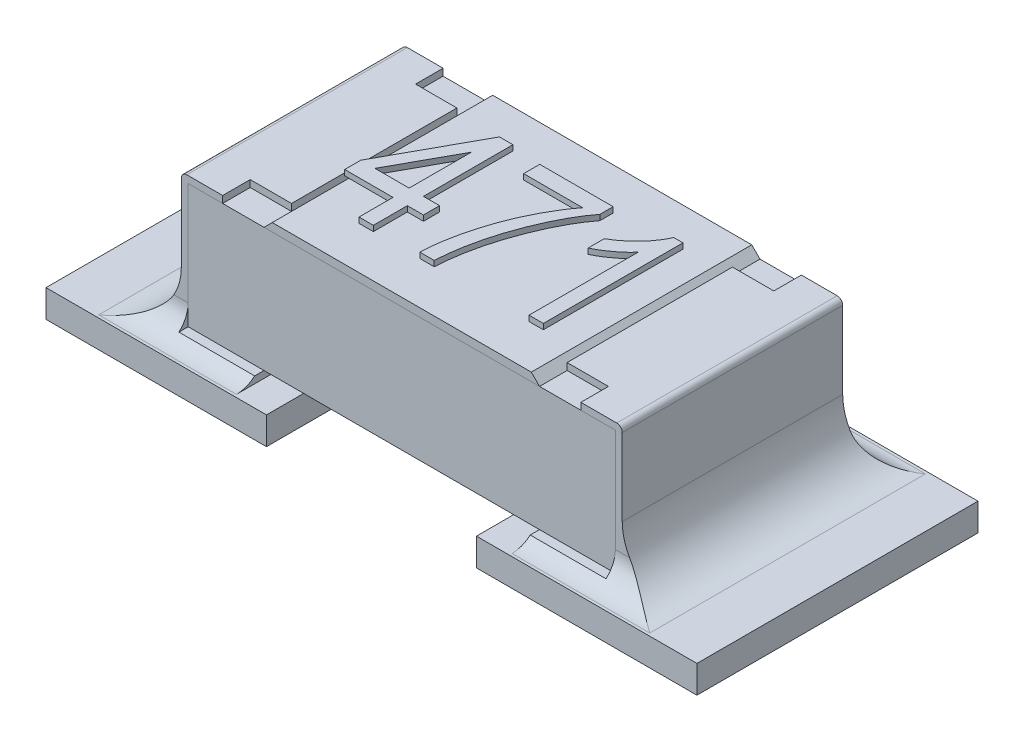
from build123d import *

# Parameters (mm, degrees)
SKETCH1_W             = 0.8
SKETCH1_H             = 0.45
BOSS_EXTRUDE1_DEPTH   = 0.775
BOSS_EXTRUDE2_DEPTH   = 0.4
BOSS_EXTRUDE2_2_DEPTH = 0.4
SKETCH3_W             = 0.15
SKETCH3_H             = 0.1
CUT_EXTRUDE1_DEPTH    = 0.025
BOSS_EXTRUDE3_DEPTH   = 0.4
SKETCH7_W             = 0.8
SKETCH7_H             = 1.02
BOSS_EXTRUDE5_DEPTH   = 0.1
FILLET3_R             = 0.2
FILLET4_R             = 0.2
FILLET5_R             = 0.1
FILLET6_R             = 0.1
BOSS_EXTRU_1_DEPTH    = 0.02


with BuildPart() as part:
    # Sketch1 → Boss-Extrude1 (new, symmetric)
    with BuildSketch(Plane(origin=(0, 0, 0), x_dir=(0, 0, -1), z_dir=(1, 0, 0))):
        with Locations((0, 0.35)):
            Rectangle(SKETCH1_W, SKETCH1_H)
    extrude(amount=BOSS_EXTRUDE1_DEPTH, both=True)


with BuildPart() as body_2:
    # Sketch2 → Boss-Extrude2 (new, symmetric)
    with BuildSketch(Plane.XY):
        with BuildLine():
            Line((-0.5, 0.6), (-0.78, 0.6))
            ThreePointArc((-0.78, 0.6), (-0.794142136, 0.594142136), (-0.8, 0.58))
            Line((-0.8, 0.58), (-0.8, 0.1))
            Line((-0.8, 0.1), (-0.5, 0.1))
            Line((-0.5, 0.1), (-0.5, 0.125))
            Line((-0.5, 0.125), (-0.775, 0.125))
            Line((-0.775, 0.125), (-0.775, 0.575))
            Line((-0.775, 0.575), (-0.5, 0.575))
            Line((-0.5, 0.575), (-0.5, 0.6))
        make_face()
    extrude(amount=BOSS_EXTRUDE2_DEPTH, both=True)


with BuildPart() as body_3:
    # Sketch2 → Boss-Extrude2 2 (new, symmetric)
    with BuildSketch(Plane.XY):
        with BuildLine():
            Line((0.5, 0.575), (0.5, 0.6))
            Line((0.5, 0.6), (0.78, 0.6))
            ThreePointArc((0.78, 0.6), (0.794142136, 0.594142136), (0.8, 0.58))
            Line((0.8, 0.58), (0.8, 0.1))
            Line((0.8, 0.1), (0.5, 0.1))
            Line((0.5, 0.1), (0.5, 0.125))
            Line((0.5, 0.125), (0.775, 0.125))
            Line((0.775, 0.125), (0.775, 0.575))
            Line((0.775, 0.575), (0.5, 0.575))
        make_face()
    extrude(amount=BOSS_EXTRUDE2_2_DEPTH, both=True)


with BuildPart() as cut_extrude1_tool:
    # Sketch3 → Cut-Extrude1 (new body)
    with BuildSketch(Plane(origin=(0, 0.6, 0), x_dir=(1, 0, 0), z_dir=(0, 1, 0))):
        with Locations((-0.575, 0.35)):
            Rectangle(SKETCH3_W, SKETCH3_H)
        with Locations((-0.575, -0.35)):
            Rectangle(SKETCH3_W, SKETCH3_H)
        with Locations((0.575, -0.35)):
            Rectangle(SKETCH3_W, SKETCH3_H)
        with Locations((0.575, 0.35)):
            Rectangle(SKETCH3_W, SKETCH3_H)
    extrude(amount=-CUT_EXTRUDE1_DEPTH)


with BuildPart() as body_2_1:
    add(body_2.part)

    # Cut-Extrude1: cut by cut_extrude1_tool
    add(cut_extrude1_tool.part, mode=Mode.SUBTRACT)



with BuildPart() as body_3_1:
    add(body_3.part)

    # Cut-Extrude1: cut by cut_extrude1_tool
    add(cut_extrude1_tool.part, mode=Mode.SUBTRACT)


with BuildPart() as body_4:
    # Sketch4 → Boss-Extrude3 (new, symmetric)
    with BuildSketch(Plane.XY):
        Polygon((-0.5, 0.575), (0.5, 0.575), (0.47, 0.605), (-0.47, 0.605), align=None)
    extrude(amount=BOSS_EXTRUDE3_DEPTH, both=True)

    # Esquisse2 → Boss.-Extru.1 (add)
    # profile 1 of 3: a face of its own
    with BuildSketch(Plane(origin=(0, 0.605, 0), x_dir=(1, 0, 0), z_dir=(0, 1, 0))):
        Polygon((-0.309886691, -0.245221888), (-0.309886691, -0.121845264), (-0.485211367, -0.121845264), (-0.485211367, -0.063403706), (-0.306944321, 0.261271619), (-0.257938639, 0.261271619), (-0.257938639, -0.063403706), (-0.199497081, -0.063403706), (-0.199497081, -0.121845264), (-0.257938639, -0.121845264), (-0.257938639, -0.245221888), align=None)
        Polygon((-0.309886691, -0.063403706), (-0.309886691, 0.162550028), (-0.433973542, -0.063403706), align=None, mode=Mode.SUBTRACT)
    # profile 2 of 3: a face of its own
    with BuildSketch(Plane(origin=(0, 0.605, 0), x_dir=(1, 0, 0), z_dir=(0, 1, 0))):
        with BuildLine():
            Line((-0.147549029, 0.189843048), (-0.147549029, 0.248284606))
            Line((-0.147549029, 0.248284606), (0.118684737, 0.248284606))
            Line((0.118684737, 0.248284606), (0.118684737, 0.200496457))
            add(Edge.make_bspline(
                [(0.118684737, 0.200496457), (0.11374506, 0.193883112), (0.103690577, 0.180421956), (0.089629665, 0.15888939), (0.075954824, 0.135956865), (0.062653235, 0.111604996), (0.049881166, 0.085755524), (0.037509723, 0.058489528), (0.02565439, 0.029704454), (0.014307924, -0.000233926), (0.003675417, -0.030854621), (-0.005742033, -0.061692329), (-0.013988634, -0.092449334), (-0.020962495, -0.123124227), (-0.026905964, -0.153701204), (-0.031550699, -0.184233606), (-0.035053075, -0.21472856), (-0.036458112, -0.235069144), (-0.037159418, -0.245221888)],
                knots=[0, 0, 0, 0, 0.828235292, 1.685834407, 2.579347319, 3.50739146, 4.469751317, 5.472290501, 6.511687755, 7.593421113, 8.685056077, 9.764080991, 10.828622054, 11.880069368, 12.920502423, 13.954003105, 14.978766756, 16, 16, 16, 16], degree=3))
            Line((-0.037159418, -0.245221888), (-0.08910747, -0.245221888))
            add(Edge.make_bspline(
                [(-0.08910747, -0.245221888), (-0.088946966, -0.239876054), (-0.088619538, -0.228970553), (-0.087305949, -0.2122975), (-0.085650055, -0.194926574), (-0.083168557, -0.176934464), (-0.080118357, -0.158294079), (-0.076411626, -0.13902896), (-0.072322113, -0.11904052), (-0.065773685, -0.091649168), (-0.056543919, -0.057339348), (-0.043279746, -0.016938754), (-0.028326509, 0.022538381), (-0.011308019, 0.060586243), (0.006839864, 0.096834643), (0.025951357, 0.13052881), (0.045471344, 0.161610603), (0.059774471, 0.180599823), (0.066736685, 0.189843048)],
                knots=[0, 0, 0, 0, 0.54755489, 1.117011975, 1.712111195, 2.334110413, 2.976306168, 3.645990646, 4.342828197, 5.06521062, 6.529487471, 7.979439287, 9.417531512, 10.850025522, 12.245424871, 13.566691952, 14.815558909, 16, 16, 16, 16], degree=3))
            Line((0.066736685, 0.189843048), (-0.147549029, 0.189843048))
        make_face()
    # profile 3 of 3: a face of its own
    with BuildSketch(Plane(origin=(0, 0.605, 0), x_dir=(1, 0, 0), z_dir=(0, 1, 0))):
        with BuildLine():
            Line((0.358944478, -0.245221888), (0.306996426, -0.245221888))
            Line((0.306996426, -0.245221888), (0.306996426, 0.150882009))
            add(Edge.make_bspline(
                [(0.306996426, 0.150882009), (0.303806106, 0.147209677), (0.297194172, 0.139598774), (0.285716194, 0.128775009), (0.272925255, 0.1176135), (0.258763988, 0.106782892), (0.244334784, 0.096408923), (0.230083263, 0.087284837), (0.216543567, 0.079346193), (0.207460341, 0.075031174), (0.203100322, 0.072959931)],
                knots=[0, 0, 0, 0, 0.892555828, 1.849821039, 2.893015883, 4.008277588, 5.121255548, 6.154629642, 7.114207698, 8, 8, 8, 8], degree=3))
            Line((0.203100322, 0.072959931), (0.203100322, 0.131401489))
            add(Edge.make_bspline(
                [(0.203100322, 0.131401489), (0.210107225, 0.13561851), (0.224061033, 0.144016443), (0.243612145, 0.158564375), (0.262081827, 0.174266475), (0.278918027, 0.191287267), (0.293992994, 0.208833156), (0.306932185, 0.226343975), (0.317541502, 0.243633673), (0.322745711, 0.255526991), (0.325259413, 0.261271619)],
                knots=[0, 0, 0, 0, 1.082272232, 2.155277244, 3.222407096, 4.289527553, 5.32168536, 6.282742408, 7.170542132, 8, 8, 8, 8], degree=3))
            Line((0.325259413, 0.261271619), (0.358944478, 0.261271619))
            Line((0.358944478, 0.261271619), (0.358944478, -0.245221888))
        make_face()
    extrude(amount=BOSS_EXTRU_1_DEPTH)


with BuildPart() as body_2_2:
    add(body_2_1.part)

    add(body_3_1.part)  # Boss-Extrude5 merges body 3
    # Sketch7 → Boss-Extrude5 (add)
    with BuildSketch(Plane(origin=(0, 0, 0), x_dir=(1, 0, 0), z_dir=(0, 1, 0))):
        with Locations((-0.781, 0)):
            Rectangle(SKETCH7_W, SKETCH7_H)
        with Locations((0.781, 0)):
            Rectangle(SKETCH7_W, SKETCH7_H)
    extrude(amount=BOSS_EXTRUDE5_DEPTH)

    # Fillet3
    fillet3_edges = [body_2_2.edges().sort_by_distance(p)[0] for p in [
        (-0.8, 0.1, 0),
    ]]
    fillet(fillet3_edges, radius=FILLET3_R)

    # Fillet4
    fillet4_edges = [body_2_2.edges().sort_by_distance(p)[0] for p in [
        (0.8, 0.1, 0),
    ]]
    fillet(fillet4_edges, radius=FILLET4_R)

    # Fillet5
    fillet5_edges = [body_2_2.edges().sort_by_distance(p)[0] for p in [
        (0.75, 0.1, 0.4),
    ]]
    fillet(fillet5_edges, radius=FILLET5_R)
    fillet5_2_edges = [body_2_2.edges().sort_by_distance(p)[0] for p in [
        (0.75, 0.1, -0.4),
    ]]
    fillet(fillet5_2_edges, radius=FILLET5_R)

    # Fillet6
    fillet6_edges = [body_2_2.edges().sort_by_distance(p)[0] for p in [
        (-0.75, 0.1, -0.4),
    ]]
    fillet(fillet6_edges, radius=FILLET6_R)
    fillet6_2_edges = [body_2_2.edges().sort_by_distance(p)[0] for p in [
        (-0.75, 0.1, 0.4),
    ]]
    fillet(fillet6_2_edges, radius=FILLET6_R)


solid = Compound([part.part, body_4.part, body_2_2.part])
